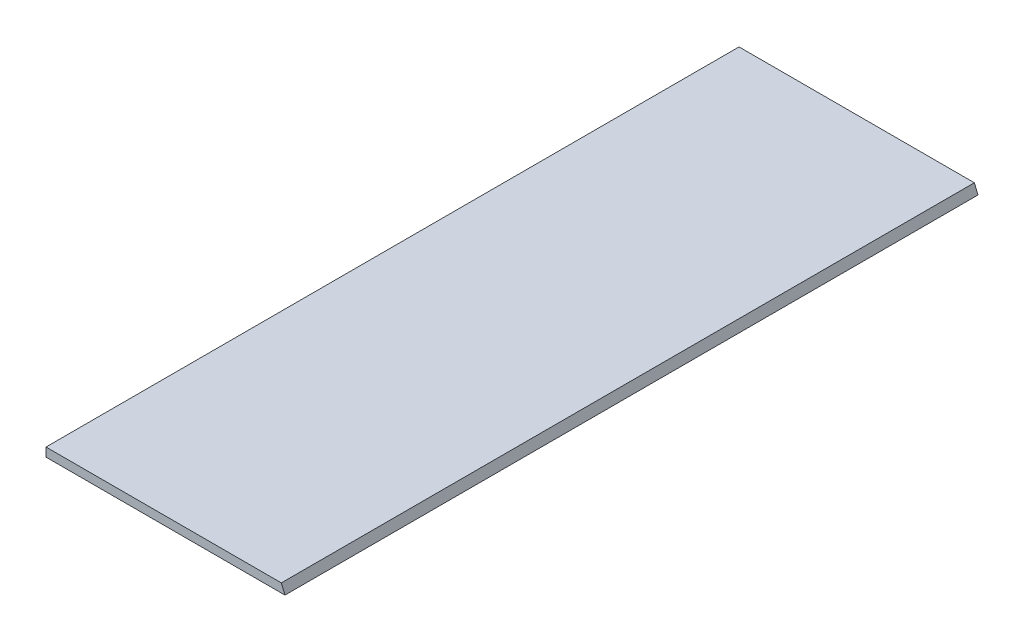
from build123d import *

# Parameters (mm, degrees)
BOSS_EXTRUDE1_DEPTH = 501.65


with BuildPart() as part:
    # Sketch1 → Boss-Extrude1 (new body)
    with BuildSketch(Plane.XY):
        Polygon((0, 0), (0, 6.35), (170.343743879, 6.35), (172.974, 0), align=None)
    extrude(amount=BOSS_EXTRUDE1_DEPTH)


solid = part.part
